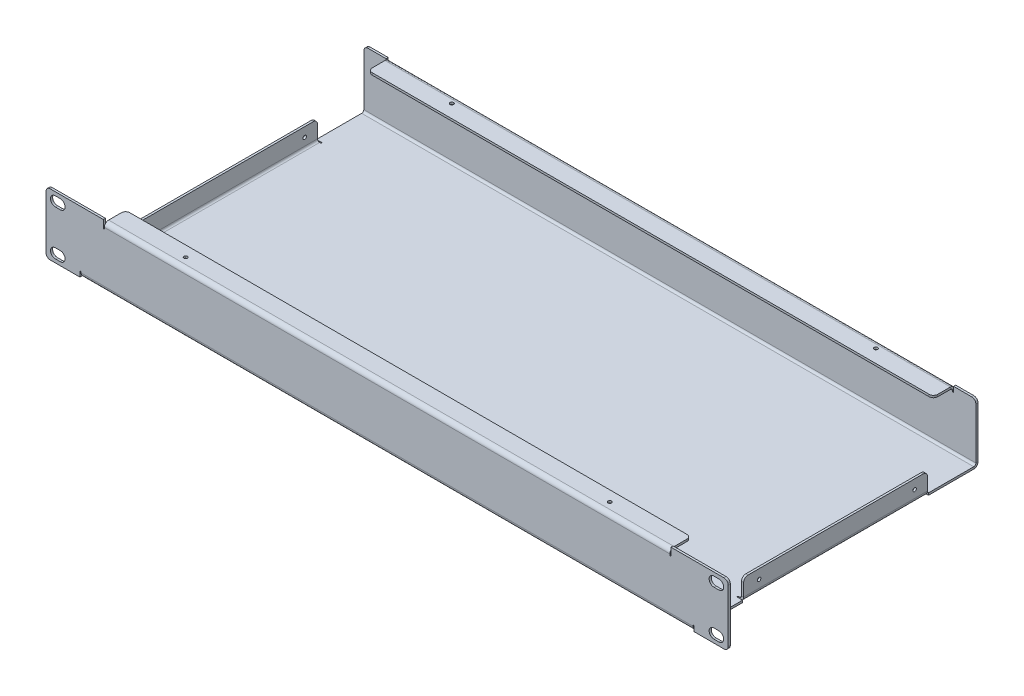
from build123d import *

# Parameters (mm, degrees)
SKETCH_1_W                        = 482.6
SKETCH_1_H                        = 43.6
SM_BASE_FLANGE_1_DEPTH            = 1.5
FILLET_1_R                        = 3
CUT_EXTRUDE_1_DEPTH               = 243.287391335
PATTERN_LINEAR_1_COUNT            = 2
PATTERN_LINEAR_1_PITCH            = 31.8
MIRROR_1_COPY_1_DEPTH             = 243.287391335
SM_START                          = -3
SM_EDGE_FLANGE_1_DEPTH            = 4
SM_START_2                        = -15
SM_EDGE_FLANGE_1_2_OUTLINE_W      = 400
SM_EDGE_FLANGE_1_2_OUTLINE_H      = 1.5
SM_EDGE_FLANGE_1_2_DEPTH          = 12
SM_START_3                        = -200
SM_EDGE_FLANGE_1_3_DEPTH          = 400
SM_EDGE_FLANGE_1_4_DEPTH          = 400
SM_EDGE_FLANGE_2_STRIP_W          = 9
SM_EDGE_FLANGE_2_STRIP_H          = 1.5
SM_EDGE_FLANGE_2_STRIP_CUT_DEPTH  = 433
SM_EDGE_FLANGE_2_RELIEF_W         = 9.75
SM_EDGE_FLANGE_2_RELIEF_H         = 0.75
SM_EDGE_FLANGE_2_RELIEF_CUT_DEPTH = 1.5
SM_EDGE_FLANGE_2_DEPTH            = 433
SM_EDGE_FLANGE_3_STRIP_W          = 10.5
SM_EDGE_FLANGE_3_STRIP_H          = 1.5
SM_EDGE_FLANGE_3_STRIP_CUT_DEPTH  = 433
SM_EDGE_FLANGE_3_DEPTH            = 433
SM_EDGE_FLANGE_4_STRIP_W          = 9
SM_EDGE_FLANGE_4_STRIP_H          = 1.5
SM_EDGE_FLANGE_4_STRIP_CUT_DEPTH  = 400
SM_EDGE_FLANGE_4_RELIEF_W         = 9.75
SM_EDGE_FLANGE_4_RELIEF_H         = 0.75
SM_EDGE_FLANGE_4_RELIEF_CUT_DEPTH = 1.5
SM_EDGE_FLANGE_4_DEPTH            = 400
SM_START_4                        = -23
SM_EDGE_FLANGE_5_DEPTH            = 1.34589
SM_START_5                        = -21.65843
SM_EDGE_FLANGE_5_2_DEPTH          = 2.85843
SM_START_6                        = -18.8
SM_EDGE_FLANGE_5_3_OUTLINE_W      = 1.5
SM_EDGE_FLANGE_5_3_OUTLINE_H      = 130
SM_EDGE_FLANGE_5_3_DEPTH          = 12
SM_START_7                        = -165.75
SM_EDGE_FLANGE_5_4_DEPTH          = 130
SM_EDGE_FLANGE_5_5_DEPTH          = 130
FILLET_2_R                        = 3
CUT_EXTRUDE_2_REACH               = 502.658
SKETCH_24_R                       = 1.25
SKETCH_25_R                       = 1.25
CUT_EXTRUDE_3_DEPTH               = 2
SKETCH_26_R                       = 1.25
CUT_EXTRUDE_4_DEPTH               = 2


with BuildPart() as part:
    # Базовая кромка1: sheet metal written as solids
    # Sketch 1 → Базовая кромка1 (new body)
    with BuildSketch(Plane.XY):
        Rectangle(SKETCH_1_W, SKETCH_1_H)
    extrude(amount=-SM_BASE_FLANGE_1_DEPTH)

    # Скругление1
    fillet_1_edges = [part.edges().sort_by_distance(p)[0] for p in [
        (-241.3, 21.8, -0.75),
        (241.3, 21.8, -0.75),
        (241.3, -21.8, -0.75),
        (-241.3, -21.8, -0.75),
    ]]
    fillet(fillet_1_edges, radius=FILLET_1_R)

    # Эскиз6 → Вырез-Вытянуть1 (cut, through all)
    with BuildSketch(Plane.XY):
        with BuildLine():
            Line((-234.7, -12.5), (-231.2, -12.5))
            ThreePointArc((-231.2, -12.5), (-227.8, -15.9), (-231.2, -19.3))
            Line((-231.2, -19.3), (-234.7, -19.3))
            ThreePointArc((-234.7, -19.3), (-238.1, -15.9), (-234.7, -12.5))
        make_face()
    cut_extrude_1 = extrude(amount=-CUT_EXTRUDE_1_DEPTH, mode=Mode.SUBTRACT)

    # Линейный массив1: Вырез-Вытянуть1 ×2
    with Locations(*[(0, i * PATTERN_LINEAR_1_PITCH, 0) for i in range(1, PATTERN_LINEAR_1_COUNT)]):
        add(cut_extrude_1, mode=Mode.SUBTRACT)

    # Зеркальное отражение1: Вырез-Вытянуть1 across plane
    add(cut_extrude_1.mirror(Plane(origin=(0, 0, 0), x_dir=(0, 0, 1), z_dir=(1, 0, 0))), mode=Mode.SUBTRACT)

    # Зеркальное отражение1 copy 1 sketch → Зеркальное отражение1 copy 1 (cut, through all)
    with BuildSketch(Plane(origin=(0, 31.8, 0), x_dir=(-1, 0, 0), z_dir=(0, 0, 1))):
        with BuildLine():
            Line((-234.7, 12.5), (-231.2, 12.5))
            ThreePointArc((-231.2, 12.5), (-227.8, 15.9), (-231.2, 19.3))
            Line((-231.2, 19.3), (-234.7, 19.3))
            ThreePointArc((-234.7, 19.3), (-238.1, 15.9), (-234.7, 12.5))
        make_face()
    extrude(amount=-MIRROR_1_COPY_1_DEPTH, mode=Mode.SUBTRACT)

    # Ребро-кромка1: read off the stored shape, not the designer's step
    # Ребро-кромка1 outline → Ребро-кромка1 (cut)
    with BuildSketch(Plane.XY.offset(SM_START)):
        with BuildLine():
            Line((200.75, 16.55), (200.75, 21.8))
            Line((200.75, 21.8), (-200.75, 21.8))
            Line((-200.75, 21.8), (-200.75, 16.55))
            ThreePointArc((-200.75, 16.55), (-200.375, 16.175), (-200, 16.55))
            Line((-200, 16.55), (-200, 20.3))
            Line((-200, 20.3), (200, 20.3))
            Line((200, 20.3), (200, 16.55))
            ThreePointArc((200, 16.55), (200.375, 16.175), (200.75, 16.55))
        make_face()
    extrude(amount=SM_EDGE_FLANGE_1_DEPTH, mode=Mode.SUBTRACT)

    # Sm Edge Flange 1 3 outline → Sm Edge Flange 1 3 (cut)
    with BuildSketch(Plane.YZ.offset(SM_START_3)):
        with BuildLine():
            ThreePointArc((17.3, 0), (18.8, -0.401923788), (19.898076212, -1.5))
            Line((19.898076212, -1.5), (20.3, -1.5))
            Line((20.3, -1.5), (20.3, 0))
            Line((20.3, 0), (17.3, 0))
        make_face()
    extrude(amount=SM_EDGE_FLANGE_1_3_DEPTH, mode=Mode.SUBTRACT)



with BuildPart() as body_2:
    # Sm Edge Flange 1 2 outline → Sm Edge Flange 1 2 (new body)
    with BuildSketch(Plane.XY.offset(SM_START_2)):
        with Locations((0, 19.55)):
            Rectangle(SM_EDGE_FLANGE_1_2_OUTLINE_W, SM_EDGE_FLANGE_1_2_OUTLINE_H)
    extrude(amount=SM_EDGE_FLANGE_1_2_DEPTH)


with BuildPart() as part_1:
    add(part.part)

    add(body_2.part)  # Sm Edge Flange 1 4 merges body 2
    # Sm Edge Flange 1 4 outline → Sm Edge Flange 1 4 (add)
    with BuildSketch(Plane.YZ.offset(SM_START_3)):
        with BuildLine():
            Line((18.8, -3), (20.3, -3))
            ThreePointArc((20.3, -3), (20.197777479, -2.223542865), (19.898076212, -1.5))
            Line((19.898076212, -1.5), (17.3, -1.5))
            ThreePointArc((17.3, -1.5), (18.360660172, -1.939339828), (18.8, -3))
        make_face()
    extrude(amount=SM_EDGE_FLANGE_1_4_DEPTH)

    # Ребро-кромка2: sheet metal written as solids
    # Ребро-кромка2 strip (on a plane across the edge) → Ребро-кромка2 strip cut (cut)
    with BuildSketch(Plane(origin=(216.5, -21.8, -1.5), x_dir=(0, 1, 0), z_dir=(-1, 0, 0))):
        with Locations((-1.5, -0.75)):
            Rectangle(SM_EDGE_FLANGE_2_STRIP_W, SM_EDGE_FLANGE_2_STRIP_H)
    extrude(amount=SM_EDGE_FLANGE_2_STRIP_CUT_DEPTH, mode=Mode.SUBTRACT)

    # Ребро-кромка2 relief (on the sheet) → Ребро-кромка2 relief cut (cut)
    with BuildSketch(Plane(origin=(216.5, -18.8, -1.5), x_dir=(0, 1, 0), z_dir=(0, 0, -1))):
        with Locations((-4.125, 0.375)):
            Rectangle(SM_EDGE_FLANGE_2_RELIEF_W, SM_EDGE_FLANGE_2_RELIEF_H)
        with Locations((-4.125, -433.375)):
            Rectangle(SM_EDGE_FLANGE_2_RELIEF_W, SM_EDGE_FLANGE_2_RELIEF_H)
    extrude(amount=-SM_EDGE_FLANGE_2_RELIEF_CUT_DEPTH, mode=Mode.SUBTRACT)

    # Ребро-кромка2 section (on a plane across the edge) → Ребро-кромка2 (add)
    with BuildSketch(Plane(origin=(216.5, -21.8, -1.5), x_dir=(0, 1, 0), z_dir=(-1, 0, 0))):
        with BuildLine():
            Line((0, 1.5), (0, 198.5))
            Line((0, 198.5), (1.5, 198.5))
            Line((1.5, 198.5), (1.5, 1.5))
            ThreePointArc((1.5, 1.5), (1.939339828, 0.439339828), (3, 0))
            Line((3, 0), (3, -1.5))
            ThreePointArc((3, -1.5), (0.878679656, -0.621320344), (0, 1.5))
        make_face()
    extrude(amount=SM_EDGE_FLANGE_2_DEPTH)

    # Ребро-кромка3: sheet metal written as solids
    # Ребро-кромка3 strip (on a plane across the edge) → Ребро-кромка3 strip cut (cut)
    with BuildSketch(Plane(origin=(216.5, -20.3, -201.5), x_dir=(0, 0, 1), z_dir=(-1, 0, 0))):
        with Locations((-2.25, -0.75)):
            Rectangle(SM_EDGE_FLANGE_3_STRIP_W, SM_EDGE_FLANGE_3_STRIP_H)
    extrude(amount=SM_EDGE_FLANGE_3_STRIP_CUT_DEPTH, mode=Mode.SUBTRACT)

    # Ребро-кромка3 section (on a plane across the edge) → Ребро-кромка3 (add)
    with BuildSketch(Plane(origin=(216.5, -20.3, -201.5), x_dir=(0, 0, 1), z_dir=(-1, 0, 0))):
        with BuildLine():
            Line((0, 1.5), (0, 40.6))
            Line((0, 40.6), (1.5, 40.6))
            Line((1.5, 40.6), (1.5, 1.5))
            ThreePointArc((1.5, 1.5), (1.939339828, 0.439339828), (3, 0))
            Line((3, 0), (3, -1.5))
            ThreePointArc((3, -1.5), (0.878679656, -0.621320344), (0, 1.5))
        make_face()
    extrude(amount=SM_EDGE_FLANGE_3_DEPTH)

    # Ребро-кромка4: sheet metal written as solids
    # Ребро-кромка4 strip (on a plane across the edge) → Ребро-кромка4 strip cut (cut)
    with BuildSketch(Plane(origin=(200, 20.3, -200), x_dir=(0, -1, 0), z_dir=(-1, 0, 0))):
        with Locations((-1.5, -0.75)):
            Rectangle(SM_EDGE_FLANGE_4_STRIP_W, SM_EDGE_FLANGE_4_STRIP_H)
    extrude(amount=SM_EDGE_FLANGE_4_STRIP_CUT_DEPTH, mode=Mode.SUBTRACT)

    # Ребро-кромка4 relief (on the sheet) → Ребро-кромка4 relief cut (cut)
    with BuildSketch(Plane(origin=(200, 17.3, -200), x_dir=(0, -1, 0), z_dir=(0, 0, 1))):
        with Locations((-4.125, 0.375)):
            Rectangle(SM_EDGE_FLANGE_4_RELIEF_W, SM_EDGE_FLANGE_4_RELIEF_H)
        with Locations((-4.125, -400.375)):
            Rectangle(SM_EDGE_FLANGE_4_RELIEF_W, SM_EDGE_FLANGE_4_RELIEF_H)
    extrude(amount=-SM_EDGE_FLANGE_4_RELIEF_CUT_DEPTH, mode=Mode.SUBTRACT)

    # Ребро-кромка4 section (on a plane across the edge) → Ребро-кромка4 (add)
    with BuildSketch(Plane(origin=(200, 20.3, -200), x_dir=(0, -1, 0), z_dir=(-1, 0, 0))):
        with BuildLine():
            Line((0, 1.5), (0, 13.5))
            Line((0, 13.5), (1.5, 13.5))
            Line((1.5, 13.5), (1.5, 1.5))
            ThreePointArc((1.5, 1.5), (1.939339828, 0.439339828), (3, 0))
            Line((3, 0), (3, -1.5))
            ThreePointArc((3, -1.5), (0.878679656, -0.621320344), (0, 1.5))
        make_face()
    extrude(amount=SM_EDGE_FLANGE_4_DEPTH)

    # Ребро-кромка5: read off the stored shape, not the designer's step
    # Ребро-кромка5 outline → Ребро-кромка5 (cut)
    with BuildSketch(Plane(origin=(0, 0, 0), x_dir=(1, 0, 0), z_dir=(0, 1, 0)).offset(SM_START_4)):
        with BuildLine():
            Line((-216.5, 35), (-212.75, 35))
            ThreePointArc((-212.75, 35), (-212.375, 35.375), (-212.75, 35.75))
            Line((-212.75, 35.75), (-215, 35.75))
            Line((-215, 35.75), (-215, 165.75))
            Line((-215, 165.75), (-212.75, 165.75))
            ThreePointArc((-212.75, 165.75), (-212.375, 166.125), (-212.75, 166.5))
            Line((-212.75, 166.5), (-216.5, 166.5))
            Line((-216.5, 166.5), (-216.5, 35))
        make_face()
        with BuildLine():
            Line((216.5, 166.5), (212.75, 166.5))
            ThreePointArc((212.75, 166.5), (212.375, 166.125), (212.75, 165.75))
            Line((212.75, 165.75), (215, 165.75))
            Line((215, 165.75), (215, 35.75))
            Line((215, 35.75), (212.75, 35.75))
            ThreePointArc((212.75, 35.75), (212.375, 35.375), (212.75, 35))
            Line((212.75, 35), (216.5, 35))
            Line((216.5, 35), (216.5, 166.5))
        make_face()
    extrude(amount=SM_EDGE_FLANGE_5_DEPTH, mode=Mode.SUBTRACT)

    # Sm Edge Flange 5 2 outline → Sm Edge Flange 5 2 (cut)
    with BuildSketch(Plane(origin=(0, 0, 0), x_dir=(1, 0, 0), z_dir=(0, 1, 0)).offset(SM_START_5)):
        with BuildLine():
            Line((-212.75, 35.75), (-216.5, 35.75))
            Line((-216.5, 35.75), (-216.5, 35))
            Line((-216.5, 35), (-212.75, 35))
            ThreePointArc((-212.75, 35), (-212.375, 35.375), (-212.75, 35.75))
        make_face()
        with BuildLine():
            Line((-216.5, 166.5), (-216.5, 165.75))
            Line((-216.5, 165.75), (-212.75, 165.75))
            ThreePointArc((-212.75, 165.75), (-212.375, 166.125), (-212.75, 166.5))
            Line((-212.75, 166.5), (-216.5, 166.5))
        make_face()
        with BuildLine():
            Line((212.75, 165.75), (216.5, 165.75))
            Line((216.5, 165.75), (216.5, 166.5))
            Line((216.5, 166.5), (212.75, 166.5))
            ThreePointArc((212.75, 166.5), (212.375, 166.125), (212.75, 165.75))
        make_face()
        with BuildLine():
            Line((216.5, 35), (216.5, 35.75))
            Line((216.5, 35.75), (212.75, 35.75))
            ThreePointArc((212.75, 35.75), (212.375, 35.375), (212.75, 35))
            Line((212.75, 35), (216.5, 35))
        make_face()
    extrude(amount=SM_EDGE_FLANGE_5_2_DEPTH, mode=Mode.SUBTRACT)

    # Sm Edge Flange 5 4 outline → Sm Edge Flange 5 4 (cut)
    with BuildSketch(Plane.XY.offset(SM_START_7)):
        with BuildLine():
            Line((216.5, -20.3), (216.098076212, -20.3))
            ThreePointArc((216.098076212, -20.3), (215, -21.398076212), (213.5, -21.8))
            Line((213.5, -21.8), (215, -21.8))
            Line((215, -21.8), (215, -21.65411))
            Line((215, -21.65411), (216.5, -21.65411))
            Line((216.5, -21.65411), (216.5, -20.3))
        make_face()
        with BuildLine():
            Line((-215, -21.8), (-213.5, -21.8))
            ThreePointArc((-213.5, -21.8), (-215, -21.398076212), (-216.098076212, -20.3))
            Line((-216.098076212, -20.3), (-216.5, -20.3))
            Line((-216.5, -20.3), (-216.5, -21.65411))
            Line((-216.5, -21.65411), (-215, -21.65411))
            Line((-215, -21.65411), (-215, -21.8))
        make_face()
    extrude(amount=SM_EDGE_FLANGE_5_4_DEPTH, mode=Mode.SUBTRACT)



with BuildPart() as body_2_2:
    # Sm Edge Flange 5 3 outline → Sm Edge Flange 5 3 (new body)
    with BuildSketch(Plane(origin=(0, 0, 0), x_dir=(1, 0, 0), z_dir=(0, 1, 0)).offset(SM_START_6)):
        with Locations((-215.75, 100.75)):
            Rectangle(SM_EDGE_FLANGE_5_3_OUTLINE_W, SM_EDGE_FLANGE_5_3_OUTLINE_H)
        with Locations((215.75, 100.75)):
            Rectangle(SM_EDGE_FLANGE_5_3_OUTLINE_W, SM_EDGE_FLANGE_5_3_OUTLINE_H)
    extrude(amount=SM_EDGE_FLANGE_5_3_DEPTH)


with BuildPart() as part_2:
    add(part_1.part)

    add(body_2_2.part)  # Sm Edge Flange 5 5 merges body 2 2
    # Sm Edge Flange 5 5 outline → Sm Edge Flange 5 5 (add)
    with BuildSketch(Plane.XY.offset(SM_START_7)):
        with BuildLine():
            ThreePointArc((216.098076212, -20.3), (216.397777479, -19.576457135), (216.5, -18.8))
            Line((216.5, -18.8), (215, -18.8))
            ThreePointArc((215, -18.8), (214.560660172, -19.860660172), (213.5, -20.3))
            Line((213.5, -20.3), (216.098076212, -20.3))
        make_face()
        with BuildLine():
            Line((-216.098076212, -20.3), (-213.5, -20.3))
            ThreePointArc((-213.5, -20.3), (-214.560660172, -19.860660172), (-215, -18.8))
            Line((-215, -18.8), (-216.5, -18.8))
            ThreePointArc((-216.5, -18.8), (-216.397777479, -19.576457135), (-216.098076212, -20.3))
        make_face()
    extrude(amount=SM_EDGE_FLANGE_5_5_DEPTH)

    # Скругление2
    fillet_2_edges = [part_2.edges().sort_by_distance(p)[0] for p in [
        (-200, 19.55, -15),
        (200, 19.55, -15),
        (216.5, 20.3, -200.75),
        (-216.5, 20.3, -200.75),
        (200, 19.55, -186.5),
        (-200, 19.55, -186.5),
        (215.75, -6.8, -35.75),
        (215.75, -6.8, -165.75),
        (-215.75, -6.8, -165.75),
        (-215.75, -6.8, -35.75),
    ]]
    fillet(fillet_2_edges, radius=FILLET_2_R)

    # Вырез-Вытянуть2: up to this face of the body (flat: up to its plane)
    cut_extrude_2_end = Plane(part_2.part.faces().sort_by_distance((216.5, -12.813230517, -100.75))[0])
    # Эскиз24 → Вырез-Вытянуть2 (cut, up to the picked face)
    with BuildSketch(Plane.ZY.offset(216.5), mode=Mode.PRIVATE) as cut_extrude_2_sk1:
        with Locations(Location((-156.65, -13.4, 0), (0, 0, 270))):
            Circle(SKETCH_24_R)
    cut_extrude_2_tool1 = split(extrude(cut_extrude_2_sk1.sketch, amount=-CUT_EXTRUDE_2_REACH, mode=Mode.PRIVATE), bisect_by=cut_extrude_2_end, keep=Keep.BOTH, mode=Mode.PRIVATE)
    # Эскиз24 → Вырез-Вытянуть2 (cut, up to the picked face)
    with BuildSketch(Plane.ZY.offset(216.5), mode=Mode.PRIVATE) as cut_extrude_2_sk2:
        with Locations(Location((-46.65, -13.4, 0), (0, 0, 270))):
            Circle(SKETCH_24_R)
    cut_extrude_2_tool2 = split(extrude(cut_extrude_2_sk2.sketch, amount=-CUT_EXTRUDE_2_REACH, mode=Mode.PRIVATE), bisect_by=cut_extrude_2_end, keep=Keep.BOTH, mode=Mode.PRIVATE)
    add(cut_extrude_2_tool1.solids().sort_by(Axis((-216.5, -13.4, -156.65), (1, 0, 0)))[0], mode=Mode.SUBTRACT)
    add(cut_extrude_2_tool2.solids().sort_by(Axis((-216.5, -13.4, -46.65), (1, 0, 0)))[0], mode=Mode.SUBTRACT)

    # Эскиз25 → Вырез-Вытянуть3 (cut)
    with BuildSketch(Plane(origin=(0, 20.3, 0), x_dir=(1, 0, 0), z_dir=(0, 1, 0))):
        with Locations(Location((-150, 7.5, 0), (0, 0, 270))):
            Circle(SKETCH_25_R)
        with Locations(Location((150, 7.5, 0), (0, 0, 270))):
            Circle(SKETCH_25_R)
    extrude(amount=-CUT_EXTRUDE_3_DEPTH, mode=Mode.SUBTRACT)

    # Эскиз26 → Вырез-Вытянуть4 (cut)
    with BuildSketch(Plane(origin=(0, 20.3, 0), x_dir=(1, 0, 0), z_dir=(0, 1, 0))):
        with Locations(Location((150, 195.8, 0), (0, 0, 270))):
            Circle(SKETCH_26_R)
        with Locations(Location((-150, 195.8, 0), (0, 0, 270))):
            Circle(SKETCH_26_R)
    extrude(amount=-CUT_EXTRUDE_4_DEPTH, mode=Mode.SUBTRACT)


solid = part_2.part
